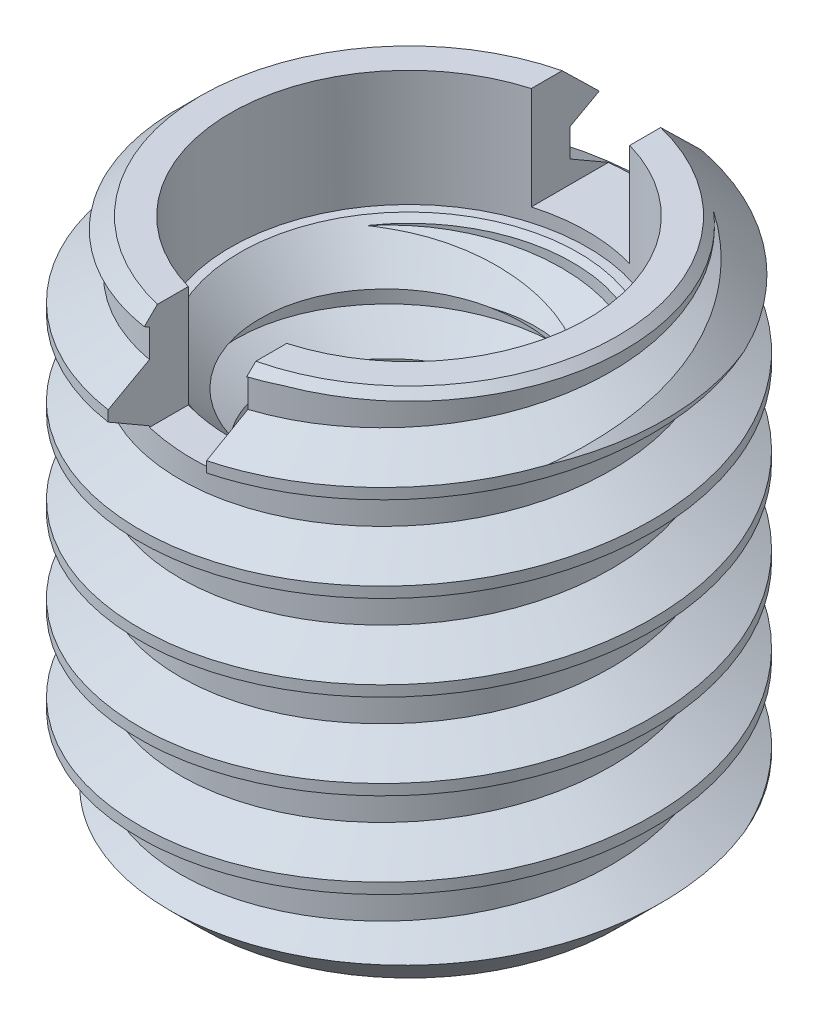
from build123d import *

# Parameters (mm, degrees)
SKETCH1_R           = 4.7625
EXTRUDE1_DEPTH      = 9.525
SKETCH2_R           = 3.3147
EXTRUDE2_DEPTH      = 2.159
EXTRUDE3_DEPTH      = 12.6656949
EXTRUDE3_DEPTH_BACK = 12.6656949
SKETCH3_W           = 1.8288
SKETCH3_H           = 1.905
SKETCH6_R           = 2.350110803
EXTRUDE4_DEPTH      = 12.6656949
CHAMFER1_SIZE       = 0.79375
CUT_SWEEP1_PITCH    = 1.27
CHAMFER2_SIZE       = 0.89296875
CUT_SWEEP2_PITCH    = 1.5875


with BuildPart() as part:
    # Sketch1 → Extrude1 (new body)
    with BuildSketch(Plane(origin=(0, 0, 0), x_dir=(1, 0, 0), z_dir=(0, 1, 0))):
        with Locations(Location((0, 0, 0), (0, 0, 270))):
            Circle(SKETCH1_R)
    extrude(amount=-EXTRUDE1_DEPTH)

    # Sketch2 → Extrude2 (cut)
    with BuildSketch(Plane(origin=(0, 0, 0), x_dir=(1, 0, 0), z_dir=(0, 1, 0))):
        with Locations(Location((0, 0, 0), (0, 0, 270))):
            Circle(SKETCH2_R)
    extrude(amount=-EXTRUDE2_DEPTH, mode=Mode.SUBTRACT)

    # Sketch3 → Extrude3 (cut, two sides: drawn at the far end of the back side and taken through both)
    with BuildSketch(Plane.XY.offset(-EXTRUDE3_DEPTH_BACK)):
        with Locations((0, -0.9525)):
            Rectangle(SKETCH3_W, SKETCH3_H)
    extrude(amount=EXTRUDE3_DEPTH + EXTRUDE3_DEPTH_BACK, mode=Mode.SUBTRACT)

    # Sketch6 → Extrude4 (cut, through all)
    with BuildSketch(Plane(origin=(0, 0, 0), x_dir=(-1, 0, 0), z_dir=(0, 1, 0))):
        with Locations(Location((0, 0, 0), (0, 0, 90))):
            Circle(SKETCH6_R)
    extrude(amount=-EXTRUDE4_DEPTH, mode=Mode.SUBTRACT)

    # Chamfer1
    chamfer1_edges = [part.edges().sort_by_distance(p)[0] for p in [
        (0, -2.159, -2.350110803),
        (0, -9.525, -2.350110803),
    ]]
    chamfer(chamfer1_edges, length=CHAMFER1_SIZE)

    # Cut-Sweep1: the profile of Sketch5 screwed along a right-hand helix of 8.5 turns, 8 arcs to a turn; built about Z, then put on its axis
    cut_sweep1_z = Axis((0, 0, 0), (0, 0, 1))
    cut_sweep1_corners = [(3.037518467, 0, -0.714375), (3.037518467, 0, -0.396875), (2.281370036, 0, 0.0396875), (2.281370036, 0, -1.1509375)]
    with BuildLine(mode=Mode.PRIVATE) as cut_sweep1_profile:
        Line(cut_sweep1_corners[0], cut_sweep1_corners[1])
        Line(cut_sweep1_corners[1], cut_sweep1_corners[2])
        Line(cut_sweep1_corners[2], cut_sweep1_corners[3])
        Line(cut_sweep1_corners[3], cut_sweep1_corners[0])
    cut_sweep1_cap = Face(cut_sweep1_profile.wire())
    cut_sweep1_turn_angles = [0, 22.5, 45, 67.5, 90, 112.5, 135, 157.5, 180, 202.5, 225, 247.5, 270, 292.5, 315, 337.5, 360]
    cut_sweep1_turn_weights = [1, 0.9238795325112867, 1, 0.9238795325112867, 1, 0.9238795325112867, 1, 0.9238795325112867, 1, 0.9238795325112867, 1, 0.9238795325112867, 1, 0.9238795325112867, 1, 0.9238795325112867, 1]
    cut_sweep1_turn_rails = [Edge.make_bspline([Vector(p[0], p[1], 0).rotate(cut_sweep1_z, cut_sweep1_turn_angles[k]) / cut_sweep1_turn_weights[k] + Vector(0, 0, p[2] + CUT_SWEEP1_PITCH * cut_sweep1_turn_angles[k] / 360) for k in range(17)], [0, 0, 0, 1, 1, 2, 2, 3, 3, 4, 4, 5, 5, 6, 6, 7, 7, 8, 8, 8], 2, cut_sweep1_turn_weights) for p in cut_sweep1_corners]
    cut_sweep1_turn_sides = [Face.make_surface_from_curves(cut_sweep1_turn_rails[p[0]], cut_sweep1_turn_rails[p[1]]) for p in [(0, 1), (1, 2), (2, 3), (3, 0)]]
    cut_sweep1_last_angles = [2880, 2902.5, 2925, 2947.5, 2970, 2992.5, 3015, 3037.5, 3060]
    cut_sweep1_last_weights = [1, 0.9238795325112867, 1, 0.9238795325112867, 1, 0.9238795325112867, 1, 0.9238795325112837, 1]
    cut_sweep1_last_rails = [Edge.make_bspline([Vector(p[0], p[1], 0).rotate(cut_sweep1_z, cut_sweep1_last_angles[k]) / cut_sweep1_last_weights[k] + Vector(0, 0, p[2] + CUT_SWEEP1_PITCH * cut_sweep1_last_angles[k] / 360) for k in range(9)], [0, 0, 0, 1, 1, 2, 2, 3, 3, 4, 4, 4], 2, cut_sweep1_last_weights) for p in cut_sweep1_corners]
    cut_sweep1_last_sides = [Face.make_surface_from_curves(cut_sweep1_last_rails[p[0]], cut_sweep1_last_rails[p[1]]) for p in [(0, 1), (1, 2), (2, 3), (3, 0)]]
    cut_sweep1 = Plane(origin=(0, 0, 0), x_dir=(-1, 0, 0), z_dir=(0, -1, 0)) * Solid(Shell([*[p.moved(Location((0, 0, CUT_SWEEP1_PITCH * i))) for i in range(8) for p in cut_sweep1_turn_sides], *cut_sweep1_last_sides, cut_sweep1_cap, cut_sweep1_cap.rotate(cut_sweep1_z, 3060).moved(Location((0, 0, CUT_SWEEP1_PITCH * 3060 / 360)))]))
    add(cut_sweep1, mode=Mode.SUBTRACT)

    # Chamfer2
    chamfer2_edges = [part.edges().sort_by_distance(p)[0] for p in [
        (4.7625, 0, 0),
        (-4.7625, 0, 0),
        (0, -9.525, -4.7625),
    ]]
    chamfer(chamfer2_edges, length=CHAMFER2_SIZE)

    # Cut-Sweep2: the profile of Sketch8 screwed along a right-hand helix of 6.8 turns, 8 arcs to a turn; built about Z, then put on its axis
    cut_sweep2_z = Axis((0, 0, 0), (0, 0, 1))
    cut_sweep2_corners = [(4.848425958, 0, -1.438671875), (4.0132, 0, -0.956453943), (4.0132, 0, -0.432608557), (4.848425958, 0, 0.049609375)]
    with BuildLine(mode=Mode.PRIVATE) as cut_sweep2_profile:
        Line(cut_sweep2_corners[0], cut_sweep2_corners[1])
        Line(cut_sweep2_corners[1], cut_sweep2_corners[2])
        Line(cut_sweep2_corners[2], cut_sweep2_corners[3])
        Line(cut_sweep2_corners[3], cut_sweep2_corners[0])
    cut_sweep2_cap = Face(cut_sweep2_profile.wire())
    cut_sweep2_turn_angles = [0, 22.5, 45, 67.5, 90, 112.5, 135, 157.5, 180, 202.5, 225, 247.5, 270, 292.5, 315, 337.5, 360]
    cut_sweep2_turn_weights = [1, 0.9238795325112867, 1, 0.9238795325112867, 1, 0.9238795325112867, 1, 0.9238795325112867, 1, 0.9238795325112867, 1, 0.9238795325112867, 1, 0.9238795325112867, 1, 0.9238795325112867, 1]
    cut_sweep2_turn_rails = [Edge.make_bspline([Vector(p[0], p[1], 0).rotate(cut_sweep2_z, cut_sweep2_turn_angles[k]) / cut_sweep2_turn_weights[k] + Vector(0, 0, p[2] + CUT_SWEEP2_PITCH * cut_sweep2_turn_angles[k] / 360) for k in range(17)], [0, 0, 0, 1, 1, 2, 2, 3, 3, 4, 4, 5, 5, 6, 6, 7, 7, 8, 8, 8], 2, cut_sweep2_turn_weights) for p in cut_sweep2_corners]
    cut_sweep2_turn_sides = [Face.make_surface_from_curves(cut_sweep2_turn_rails[p[0]], cut_sweep2_turn_rails[p[1]]) for p in [(0, 1), (1, 2), (2, 3), (3, 0)]]
    cut_sweep2_last_angles = [2160, 2182.5, 2205, 2227.5, 2250, 2272.5, 2295, 2317.5, 2340, 2362.5, 2385, 2407.5, 2430, 2439, 2448]
    cut_sweep2_last_weights = [1, 0.9238795325112867, 1, 0.9238795325112867, 1, 0.9238795325112867, 1, 0.9238795325112867, 1, 0.9238795325112867, 1, 0.9238795325112867, 1, 0.9876883405951316, 1]
    cut_sweep2_last_rails = [Edge.make_bspline([Vector(p[0], p[1], 0).rotate(cut_sweep2_z, cut_sweep2_last_angles[k]) / cut_sweep2_last_weights[k] + Vector(0, 0, p[2] + CUT_SWEEP2_PITCH * cut_sweep2_last_angles[k] / 360) for k in range(15)], [0, 0, 0, 1, 1, 2, 2, 3, 3, 4, 4, 5, 5, 6, 6, 7, 7, 7], 2, cut_sweep2_last_weights) for p in cut_sweep2_corners]
    cut_sweep2_last_sides = [Face.make_surface_from_curves(cut_sweep2_last_rails[p[0]], cut_sweep2_last_rails[p[1]]) for p in [(0, 1), (1, 2), (2, 3), (3, 0)]]
    cut_sweep2 = Plane(origin=(0, 0, 0), x_dir=(-1, 0, 0), z_dir=(0, -1, 0)) * Solid(Shell([*[p.moved(Location((0, 0, CUT_SWEEP2_PITCH * i))) for i in range(6) for p in cut_sweep2_turn_sides], *cut_sweep2_last_sides, cut_sweep2_cap, cut_sweep2_cap.rotate(cut_sweep2_z, 2448).moved(Location((0, 0, CUT_SWEEP2_PITCH * 2448 / 360)))]))
    add(cut_sweep2, mode=Mode.SUBTRACT)


solid = part.part
